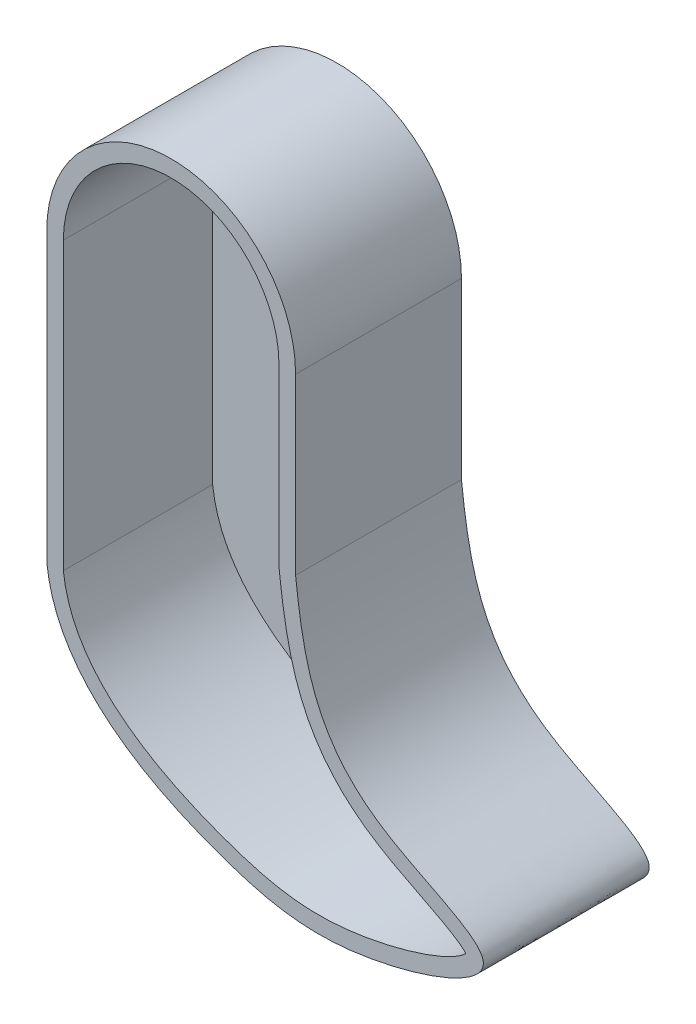
from build123d import *

# Parameters (mm, degrees)
EXTRUDE_1_DEPTH     = 10
SHELL_START         = 1
SHELL_1_DEPTH       = 9
SKETCH_2_R          = 2.5
CUT_EXTRUDE_1_DEPTH = 10


# Read off the part's stored shape, not the designer's step: 抽壳1
with BuildPart() as part:
    # 草图1 → 凸台-拉伸1 (new body)
    with BuildSketch(Plane.XY):
        with BuildLine():
            Line((7.5, 0), (7.5, -10.504729681))
            add(Edge.make_bspline(
                [(7.5, -10.504729681), (8.021297076, -15.201657173), (9.305875164, -20.560899138), (22.674798815, -25.226221765), (10.340482522, -29.322656715), (1.363586224, -27.372940981), (-6.896258848, -22.879586958), (-7.5, -17.316908959)],
                knots=[0, 0, 0, 0, 0.243808159, 0.379428047, 0.541667533, 0.697632694, 1, 1, 1, 1], degree=3))
            Line((-7.5, -17.316908959), (-7.5, 0))
            ThreePointArc((-7.5, 0), (0, 7.5), (7.5, 0))
        make_face()
    extrude(amount=EXTRUDE_1_DEPTH)

    # 抽壳1 outline → 抽壳1 (cut)
    with BuildSketch(Plane.XY.offset(SHELL_START)):
        with BuildLine():
            add(Edge.make_bspline(
                [(-6.500000009, -17.261239946), (-6.439521574, -17.787014962), (-6.344378656, -18.291379533), (-6.216503917, -18.775790534), (-6.057602845, -19.241769619), (-5.869061295, -19.690801085), (-5.652006063, -20.124169377), (-5.407432213, -20.542850953), (-5.136335902, -20.947498631), (-4.839814395, -21.338503833), (-4.519115679, -21.716093294), (-4.175638775, -22.080411869), (-3.810902274, -22.431561965), (-3.426513038, -22.769612908), (-2.821587443, -23.258334971), (-2.614444932, -23.418712944), (-2.402969473, -23.575804398), (-2.187383641, -23.729621088), (-1.967914267, -23.880176358), (-1.744791966, -24.027485226), (-1.518250665, -24.171564464), (-1.288527132, -24.312432689), (-1.055860502, -24.45011044), (-0.820491812, -24.58462027), (-0.582663519, -24.715986822), (-0.342619037, -24.844236919), (-0.100602262, -24.969399649), (0.265015483, -25.15255984), (0.387320101, -25.212849094), (0.51002612, -25.272378081), (0.633102897, -25.331150773), (0.75651978, -25.389171243), (0.880246108, -25.446443655), (1.004251211, -25.502972279), (1.128504412, -25.558761473), (1.252975025, -25.6138157), (1.377632354, -25.668139515), (1.502445697, -25.721737575), (1.627384342, -25.77461463), (1.752417569, -25.82677553), (2.002611728, -25.929674913), (2.127766911, -25.980411342), (2.253011575, -26.030461002), (2.377987526, -26.079714974), (2.503785661, -26.128568389), (2.627609853, -26.176064588), (2.754597489, -26.224006146), (2.877193277, -26.26978137), (3.004027738, -26.316407793), (3.127146022, -26.361134901), (3.252267932, -26.405968006), (3.376088153, -26.449773736), (3.500008034, -26.493055613), (4.117650303, -26.706072948), (4.601908488, -26.864367649), (5.079104851, -27.009296305), (5.552184472, -27.13971904), (6.024207687, -27.254620307), (6.498435977, -27.353094421), (6.978393154, -27.434275307), (7.467842238, -27.497228795), (7.970681116, -27.540848515), (8.490798642, -27.563799937), (9.031947117, -27.564541002), (9.59767725, -27.541412388), (10.191347545, -27.492735577), (10.855212698, -27.41203554), (10.894383743, -27.40718205), (10.933688303, -27.402220592), (10.973082312, -27.397155371), (11.012647176, -27.391976573), (11.0523281, -27.386691379), (11.092084436, -27.381303738), (11.131987346, -27.375803413), (11.172081681, -27.370185191), (11.212286608, -27.364460752), (11.252556085, -27.358635862), (11.293007581, -27.352694085), (11.33354738, -27.346648992), (11.414860672, -27.334343842), (11.455629284, -27.328084455), (11.496506339, -27.321718833), (11.537488317, -27.31524755), (11.578571696, -27.308671184), (11.619752953, -27.301990307), (11.661028569, -27.295205501), (11.70239502, -27.288317335), (11.743848786, -27.281326391), (11.785386345, -27.274233239), (11.827004176, -27.267038459), (11.868698756, -27.259742626), (11.910466564, -27.252346315), (12.035979109, -27.229857676), (12.119933246, -27.214465791), (12.204138822, -27.198679195), (12.288568223, -27.182502683), (12.373193892, -27.165941094), (12.457988323, -27.148999312), (12.542924069, -27.131682271), (12.627973732, -27.113994941), (12.713109974, -27.095942349), (12.798305507, -27.077529558), (12.883533101, -27.058761682), (12.968765579, -27.039643878), (13.053975819, -27.020181349), (13.309458619, -26.960775334), (13.479583039, -26.919812934), (13.649292236, -26.87753502), (13.818368754, -26.83398472), (13.9865951, -26.789205733), (14.153753381, -26.743242655), (14.319624936, -26.696141279), (14.483989989, -26.64794894), (14.646627269, -26.598714807), (14.807313664, -26.548490225), (14.965823847, -26.497329013), (15.121929924, -26.445287801), (15.275401064, -26.392426333), (15.674695935, -26.250266234), (15.915555272, -26.159666588), (16.147585922, -26.067269509), (16.369520611, -25.973478269), (16.580528875, -25.878549667), (16.779216707, -25.782972605), (16.964351397, -25.687304088), (17.134803871, -25.592118409), (17.289098165, -25.498219034), (17.425639821, -25.406772075), (17.542980088, -25.319278816), (17.639315715, -25.237879944), (17.713179597, -25.166266037), (17.764963789, -25.109158429)],
                knots=[0.0010636, 0.0010636, 0.0010636, 0.0010636, 0.0010636, 0.0010636, 0.0010636, 0.0010636, 0.0010636, 0.0010636, 0.0010636, 0.0010636, 0.0010636, 0.0010636, 0.0010636, 0.151235255, 0.151235255, 0.151235255, 0.151235255, 0.151235255, 0.151235255, 0.151235255, 0.151235255, 0.151235255, 0.151235255, 0.151235255, 0.151235255, 0.151235255, 0.226852882, 0.226852882, 0.226852882, 0.226852882, 0.226852882, 0.226852882, 0.226852882, 0.226852882, 0.226852882, 0.226852882, 0.226852882, 0.226852882, 0.226852882, 0.264661696, 0.264661696, 0.264661696, 0.264661696, 0.264661696, 0.264661696, 0.264661696, 0.264661696, 0.264661696, 0.264661696, 0.264661696, 0.264661696, 0.264661696, 0.302470509, 0.302470509, 0.302470509, 0.302470509, 0.302470509, 0.302470509, 0.302470509, 0.302470509, 0.302470509, 0.302470509, 0.302470509, 0.302470509, 0.302470509, 0.453705764, 0.453705764, 0.453705764, 0.453705764, 0.453705764, 0.453705764, 0.453705764, 0.453705764, 0.453705764, 0.453705764, 0.453705764, 0.453705764, 0.453705764, 0.463157967, 0.463157967, 0.463157967, 0.463157967, 0.463157967, 0.463157967, 0.463157967, 0.463157967, 0.463157967, 0.463157967, 0.463157967, 0.463157967, 0.463157967, 0.472610171, 0.472610171, 0.472610171, 0.472610171, 0.472610171, 0.472610171, 0.472610171, 0.472610171, 0.472610171, 0.472610171, 0.472610171, 0.472610171, 0.472610171, 0.491514578, 0.491514578, 0.491514578, 0.491514578, 0.491514578, 0.491514578, 0.491514578, 0.491514578, 0.491514578, 0.491514578, 0.491514578, 0.491514578, 0.491514578, 0.529323391, 0.529323391, 0.529323391, 0.529323391, 0.529323391, 0.529323391, 0.529323391, 0.529323391, 0.529323391, 0.529323391, 0.529323391, 0.529323391, 0.529323391, 0.591757983, 0.591757983, 0.591757983, 0.591757983, 0.591757983, 0.591757983, 0.591757983, 0.591757983, 0.591757983, 0.591757983, 0.591757983, 0.591757983, 0.591757983, 0.591757983, 0.591757983], degree=14))
            add(Edge.make_bspline(
                [(17.764963789, -25.109158429), (17.69308935, -25.029546237), (17.581363239, -24.922665167), (17.430157138, -24.799876622), (17.245494319, -24.668295233), (17.031995847, -24.529465421), (16.792325971, -24.386016517), (16.532816172, -24.238523167), (16.25218172, -24.086787627), (15.958640238, -23.932704172), (15.6504144, -23.774561622), (15.333242725, -23.613761402), (15.008254158, -23.449482472), (14.678460819, -23.281831185), (14.250120026, -23.060967848), (14.153853927, -23.011130304), (14.057439385, -22.960979577), (13.960934377, -22.910509026), (13.864396297, -22.859711452), (13.76788195, -22.808579035), (13.671447549, -22.757103277), (13.57514871, -22.705274943), (13.479040446, -22.653083998), (13.383177159, -22.600519554), (13.287612644, -22.547569807), (13.192400075, -22.494221978), (13.097592004, -22.440462252), (12.979652446, -22.372729092), (12.956093088, -22.359155838), (12.93256308, -22.345555697), (12.90906322, -22.331928406), (12.885594307, -22.318273701), (12.862157136, -22.304591318), (12.838752507, -22.290880993), (12.815381217, -22.277142464), (12.792044063, -22.263375464), (12.768741842, -22.249579733), (12.745475354, -22.235755003), (12.722245394, -22.221901014), (12.699052761, -22.208017499), (12.664320998, -22.187147546), (12.65275327, -22.180183436), (12.641195165, -22.17321183), (12.62964678, -22.166232687), (12.618108213, -22.15924597), (12.60657956, -22.152251635), (12.59506092, -22.14524965), (12.583552387, -22.138239969), (12.572054063, -22.131222558), (12.560566041, -22.124197374), (12.54908842, -22.117164381), (12.537621297, -22.110123537), (12.526164769, -22.103074805), (12.503273098, -22.088961484), (12.491839529, -22.08189789), (12.480411702, -22.074823164), (12.4689959, -22.067741075), (12.457597404, -22.060654849), (12.446216952, -22.053564968), (12.434852342, -22.046470105), (12.423501428, -22.039368962), (12.412164066, -22.032261436), (12.400841956, -22.02514856), (12.389536629, -22.018031265), (12.378247207, -22.01090903), (12.366970879, -22.003780159), (12.310668589, -21.968110992), (12.26586852, -21.93948894), (12.221309566, -21.910779961), (12.176991082, -21.881983847), (12.13291242, -21.853100386), (12.089072934, -21.824129374), (12.045471975, -21.795070596), (12.0021089, -21.76592385), (11.958983059, -21.736688919), (11.916093806, -21.707365601), (11.873440494, -21.677953682), (11.831022477, -21.648452955), (11.788839108, -21.618863212), (11.579092265, -21.470468362), (11.415040184, -21.350326211), (11.254693781, -21.228745952), (11.098015265, -21.105717816), (10.944968475, -20.981234181), (10.795518593, -20.855289653), (10.649631854, -20.72788115), (10.507275262, -20.599007983), (10.368416295, -20.468671932), (10.233022621, -20.336877336), (10.101061809, -20.203631167), (9.972501036, -20.068943117), (9.847306806, -19.932825674), (9.481720349, -19.520231279), (9.25132434, -19.239511712), (9.033975364, -18.953249598), (8.829378566, -18.661601074), (8.637207543, -18.364752653), (8.457093915, -18.062908055), (8.288623211, -17.756274548), (8.131335844, -17.445049765), (7.984731973, -17.129410032), (7.848279021, -16.809501148), (7.721420655, -16.485432659), (7.603585989, -16.157276584), (7.494197819, -15.825071602), (7.341919075, -15.320714735), (7.293126813, -15.15158724), (7.246229307, -14.981452714), (7.201154126, -14.810310831), (7.157829039, -14.638159557), (7.116182085, -14.464995291), (7.076141641, -14.29081299), (7.037636491, -14.115606313), (7.00059589, -13.939367743), (6.964949637, -13.76208873), (6.930628141, -13.583759818), (6.89756249, -13.404370783), (6.86568452, -13.223910762), (6.819548058, -12.951597206), (6.804449279, -12.860555451), (6.789622099, -12.769241672), (6.775058117, -12.677654388), (6.760748967, -12.585792101), (6.746686324, -12.493653289), (6.7328619, -12.401236408), (6.719267448, -12.308539894), (6.705894756, -12.215562161), (6.692735655, -12.1223016), (6.67978201, -12.028756581), (6.667025727, -11.934925453), (6.654458752, -11.840806543), (6.635880223, -11.699193963), (6.629732678, -11.651917412), (6.623629439, -11.604568292), (6.617569515, -11.55714639), (6.611551915, -11.509651496), (6.605575648, -11.462083396), (6.599639721, -11.414441881), (6.593743144, -11.366726736), (6.587884925, -11.318937752), (6.582064073, -11.271074715), (6.576279596, -11.223137414), (6.570530503, -11.175125636), (6.564815803, -11.127039172), (6.556293855, -11.054797125), (6.55346156, -11.030697717), (6.550637498, -11.006579556), (6.547821547, -10.982442615), (6.545013585, -10.958286868), (6.542213489, -10.934112288), (6.539421139, -10.909918848), (6.536636412, -10.885706521), (6.533859187, -10.861475281), (6.531089341, -10.8372251), (6.528326752, -10.812955952), (6.525571299, -10.78866781), (6.52282286, -10.764360647), (6.519395925, -10.733952883), (6.518710969, -10.72787014), (6.518026442, -10.721786206), (6.517342342, -10.715701081), (6.516658667, -10.709614764), (6.515975415, -10.703527254), (6.515292585, -10.697438553), (6.514610174, -10.691348657), (6.513928181, -10.68525757), (6.513246603, -10.679165287), (6.512565439, -10.673071811), (6.511884687, -10.66697714), (6.511204345, -10.660881274), (6.510354427, -10.653259946), (6.510184469, -10.651735606), (6.510014537, -10.650211191), (6.50984463, -10.648686702), (6.509674748, -10.647162138), (6.509504892, -10.645637498), (6.509335061, -10.644112785), (6.509165255, -10.642587996), (6.508995475, -10.641063133), (6.50882572, -10.639538194), (6.508655991, -10.638013181), (6.508486286, -10.636488094), (6.508316607, -10.634962931), (6.508062125, -10.632675075), (6.507977305, -10.631912438), (6.50789249, -10.631149782), (6.507807682, -10.630387107), (6.50772288, -10.629624414), (6.507638084, -10.628861701), (6.507553295, -10.628098971), (6.507468512, -10.627336221), (6.507383735, -10.626573453), (6.507298964, -10.625810666), (6.5072142, -10.62504786), (6.507129441, -10.624285036), (6.50704469, -10.623522193), (6.506917571, -10.6223779), (6.5068752, -10.621996464), (6.50683283, -10.621615024), (6.506790462, -10.621233579), (6.506748095, -10.620852129), (6.506705731, -10.620470676), (6.506663367, -10.620089216), (6.506621005, -10.619707753), (6.506578645, -10.619326284), (6.506536286, -10.618944811), (6.506493929, -10.618563333), (6.506451573, -10.618181851), (6.506409219, -10.617800364), (6.506324514, -10.617037381), (6.50628245, -10.616658464), (6.50623885, -10.616265761), (6.506198111, -10.615898568), (6.506156929, -10.615527789), (6.506110303, -10.615107635), (6.506068107, -10.614727232), (6.506031797, -10.614400204), (6.505988866, -10.614013504), (6.505942043, -10.613591427), (6.505905665, -10.613263787), (6.505861429, -10.612865173), (6.505820089, -10.612492699), (6.505443943, -10.609103597), (6.505109591, -10.606091061), (6.504775239, -10.603078526), (6.504440888, -10.600065991), (6.504106536, -10.597053456), (6.503772184, -10.59404092), (6.503437833, -10.591028385), (6.503103481, -10.588015849), (6.502769129, -10.585003314), (6.502434777, -10.581990779), (6.502100426, -10.578978244), (6.501766074, -10.575965708), (6.501431722, -10.572953173), (6.501018987, -10.569234395), (6.500940603, -10.568528153), (6.50086222, -10.567821911), (6.500783836, -10.567115668), (6.500705452, -10.566409426), (6.500627069, -10.565703184), (6.500548685, -10.564996941), (6.500470302, -10.564290699), (6.500391918, -10.563584457), (6.500313534, -10.562878215), (6.500235151, -10.562171972), (6.500156767, -10.56146573), (6.500078384, -10.560759488), (6.5, -10.560053245)],
                knots=[0.64269819, 0.64269819, 0.64269819, 0.64269819, 0.64269819, 0.64269819, 0.64269819, 0.64269819, 0.64269819, 0.64269819, 0.64269819, 0.64269819, 0.64269819, 0.64269819, 0.64269819, 0.723475835, 0.723475835, 0.723475835, 0.723475835, 0.723475835, 0.723475835, 0.723475835, 0.723475835, 0.723475835, 0.723475835, 0.723475835, 0.723475835, 0.723475835, 0.746827792, 0.746827792, 0.746827792, 0.746827792, 0.746827792, 0.746827792, 0.746827792, 0.746827792, 0.746827792, 0.746827792, 0.746827792, 0.746827792, 0.746827792, 0.752665781, 0.752665781, 0.752665781, 0.752665781, 0.752665781, 0.752665781, 0.752665781, 0.752665781, 0.752665781, 0.752665781, 0.752665781, 0.752665781, 0.752665781, 0.755584776, 0.755584776, 0.755584776, 0.755584776, 0.755584776, 0.755584776, 0.755584776, 0.755584776, 0.755584776, 0.755584776, 0.755584776, 0.755584776, 0.755584776, 0.75850377, 0.75850377, 0.75850377, 0.75850377, 0.75850377, 0.75850377, 0.75850377, 0.75850377, 0.75850377, 0.75850377, 0.75850377, 0.75850377, 0.75850377, 0.770179749, 0.770179749, 0.770179749, 0.770179749, 0.770179749, 0.770179749, 0.770179749, 0.770179749, 0.770179749, 0.770179749, 0.770179749, 0.770179749, 0.770179749, 0.816883663, 0.816883663, 0.816883663, 0.816883663, 0.816883663, 0.816883663, 0.816883663, 0.816883663, 0.816883663, 0.816883663, 0.816883663, 0.816883663, 0.816883663, 0.910291491, 0.910291491, 0.910291491, 0.910291491, 0.910291491, 0.910291491, 0.910291491, 0.910291491, 0.910291491, 0.910291491, 0.910291491, 0.910291491, 0.910291491, 0.956995406, 0.956995406, 0.956995406, 0.956995406, 0.956995406, 0.956995406, 0.956995406, 0.956995406, 0.956995406, 0.956995406, 0.956995406, 0.956995406, 0.956995406, 0.980347363, 0.980347363, 0.980347363, 0.980347363, 0.980347363, 0.980347363, 0.980347363, 0.980347363, 0.980347363, 0.980347363, 0.980347363, 0.980347363, 0.980347363, 0.992023341, 0.992023341, 0.992023341, 0.992023341, 0.992023341, 0.992023341, 0.992023341, 0.992023341, 0.992023341, 0.992023341, 0.992023341, 0.992023341, 0.992023341, 0.997861331, 0.997861331, 0.997861331, 0.997861331, 0.997861331, 0.997861331, 0.997861331, 0.997861331, 0.997861331, 0.997861331, 0.997861331, 0.997861331, 0.997861331, 0.999320828, 0.999320828, 0.999320828, 0.999320828, 0.999320828, 0.999320828, 0.999320828, 0.999320828, 0.999320828, 0.999320828, 0.999320828, 0.999320828, 0.999320828, 0.999685702, 0.999685702, 0.999685702, 0.999685702, 0.999685702, 0.999685702, 0.999685702, 0.999685702, 0.999685702, 0.999685702, 0.999685702, 0.999685702, 0.999685702, 0.999868139, 0.999868139, 0.999868139, 0.999868139, 0.999868139, 0.999868139, 0.999868139, 0.999868139, 0.999868139, 0.999868139, 0.999868139, 0.999868139, 0.999868139, 0.999959358, 0.999959358, 0.999959358, 0.999959358, 0.999959358, 0.999959358, 0.999959358, 0.999959358, 0.999959358, 0.999959358, 0.999959358, 0.999959358, 0.999959358, 1.000050577, 1.000050577, 1.000050577, 1.000050577, 1.000050577, 1.000050577, 1.000050577, 1.000050577, 1.000050577, 1.000050577, 1.000050577, 1.000050577, 1.000050577, 1.000780325, 1.000780325, 1.000780325, 1.000780325, 1.000780325, 1.000780325, 1.000780325, 1.000780325, 1.000780325, 1.000780325, 1.000780325, 1.000780325, 1.000780325, 1.000951404, 1.000951404, 1.000951404, 1.000951404, 1.000951404, 1.000951404, 1.000951404, 1.000951404, 1.000951404, 1.000951404, 1.000951404, 1.000951404, 1.000951404, 1.000951404, 1.000951404], degree=14))
            Line((6.5, -10.560053245), (6.5, 0))
            ThreePointArc((6.5, 0), (0, 6.5), (-6.5, 0))
            Line((-6.5, 0), (-6.500000009, -17.261239946))
        make_face()
    extrude(amount=SHELL_1_DEPTH, mode=Mode.SUBTRACT)

    # 草图2 → 切除-拉伸1 (cut)
    with BuildSketch(Plane(origin=(0, 0, 0), x_dir=(-1, 0, 0), z_dir=(0, 0, -1))):
        Circle(SKETCH_2_R)
    extrude(amount=-CUT_EXTRUDE_1_DEPTH, mode=Mode.SUBTRACT)


solid = part.part
